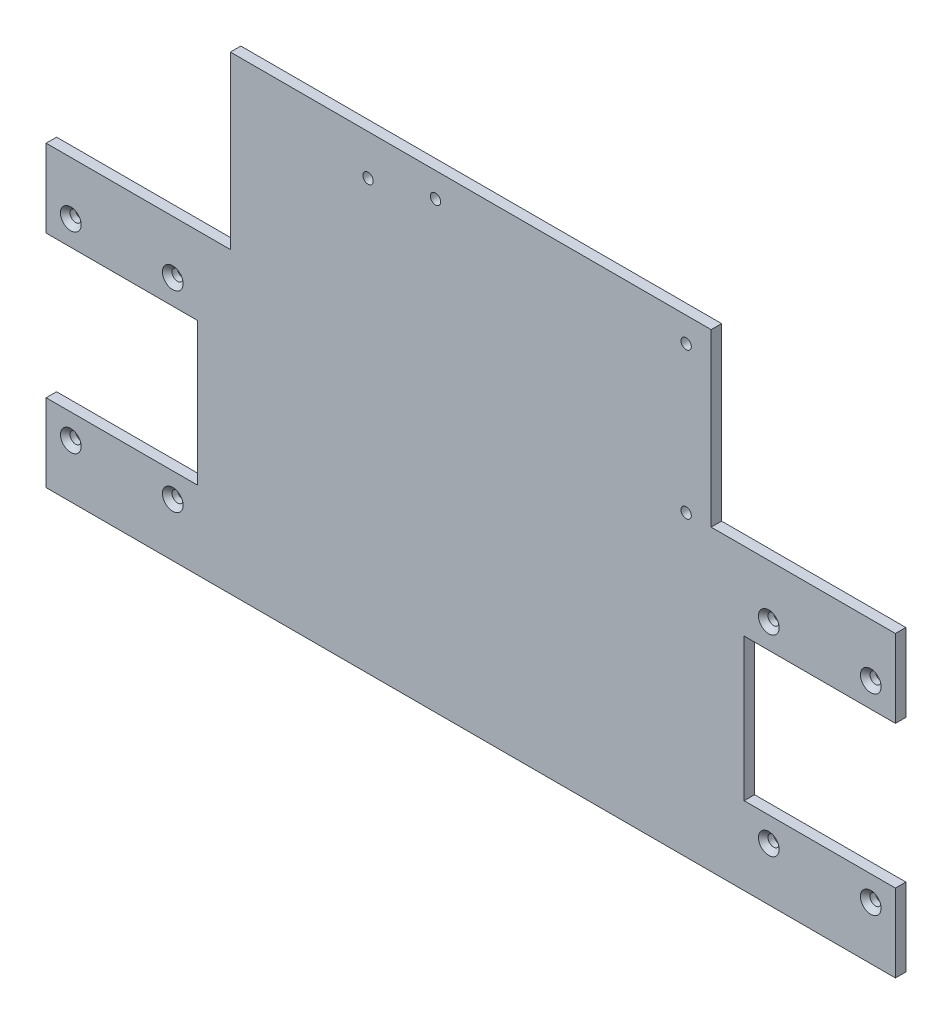
from build123d import *

# Parameters (mm, degrees)
PROFILE_EXTRUDE_DEPTH                           = 3.175
CSK_FOR_M3_FLAT_HEAD_MACHINE_SCREW1_D           = 3.4
CSK_FOR_M3_FLAT_HEAD_MACHINE_SCREW1_CSINK_D     = 6.3
CSK_FOR_M3_FLAT_HEAD_MACHINE_SCREW1_CSINK_ANGLE = 90
FILM_FEEDER_CLEARANCE_SKETCH_W                  = 46
FILM_FEEDER_CLEARANCE_SKETCH_H                  = 43.35
FILM_FEEDER_CLEARANCE_CUT_DEPTH                 = 162.721715162
GANTRY_MOUNTING_HOLE_SKETCH_R                   = 1.575
GANTRY_MOUNTING_HOLE_CUT_DEPTH                  = 162.721715162
ERASER_MOUNTING_HOLE_SKETCH_R                   = 1.575
ERASER_MOUNTING_HOLE_CUT_DEPTH                  = 162.721715162


with BuildPart() as part:
    # Profile Sketch → Profile Extrude (new body)
    with BuildSketch(Plane.XY):
        Polygon((73.090000006, 45.35), (129.1, 45.35), (129.1, -45.35), (-129.1, -45.35), (-129.1, 45.35), (-73.090000006, 45.35), (-73.090000006, 97.350000154), (73.090000006, 97.350000154), align=None)
    extrude(amount=PROFILE_EXTRUDE_DEPTH)

    # CSK for M3 Flat Head Machine Screw1 (through all)
    with Locations(Plane(origin=(-121.6, 29.175, 3.175), x_dir=(1, 0, 0), z_dir=(0, 0, 1))):
        with Locations((0, 0), (31, 0), (31, -58.35), (0, -58.35), (212.2, 0), (243.2, 0), (243.2, -58.35), (212.2, -58.35)):
            CounterSinkHole(CSK_FOR_M3_FLAT_HEAD_MACHINE_SCREW1_D / 2, CSK_FOR_M3_FLAT_HEAD_MACHINE_SCREW1_CSINK_D / 2, counter_sink_angle=CSK_FOR_M3_FLAT_HEAD_MACHINE_SCREW1_CSINK_ANGLE)

    # Film Feeder Clearance Sketch → Film Feeder Clearance Cut (cut, through all)
    with BuildSketch(Plane.XY.offset(3.175)):
        with Locations((-106.1, 0)):
            Rectangle(FILM_FEEDER_CLEARANCE_SKETCH_W, FILM_FEEDER_CLEARANCE_SKETCH_H)
        with Locations((106.1, 0)):
            Rectangle(FILM_FEEDER_CLEARANCE_SKETCH_W, FILM_FEEDER_CLEARANCE_SKETCH_H)
    extrude(amount=-FILM_FEEDER_CLEARANCE_CUT_DEPTH, mode=Mode.SUBTRACT)

    # Gantry Mounting Hole Sketch → Gantry Mounting Hole Cut (cut, through all)
    with BuildSketch(Plane.XY.offset(3.175)):
        with Locations((-10.729999994, 89.850000154)):
            Circle(GANTRY_MOUNTING_HOLE_SKETCH_R)
        with Locations((65.470000006, 89.850000154)):
            Circle(GANTRY_MOUNTING_HOLE_SKETCH_R)
        with Locations((65.470000006, 45.350000154)):
            Circle(GANTRY_MOUNTING_HOLE_SKETCH_R)
    extrude(amount=-GANTRY_MOUNTING_HOLE_CUT_DEPTH, mode=Mode.SUBTRACT)

    # Eraser Mounting Hole Sketch → Eraser Mounting Hole Cut (cut, through all)
    with BuildSketch(Plane.XY.offset(3.175)):
        with Locations((-31.230000142, 85.0500001)):
            Circle(ERASER_MOUNTING_HOLE_SKETCH_R)
    extrude(amount=-ERASER_MOUNTING_HOLE_CUT_DEPTH, mode=Mode.SUBTRACT)


solid = part.part
